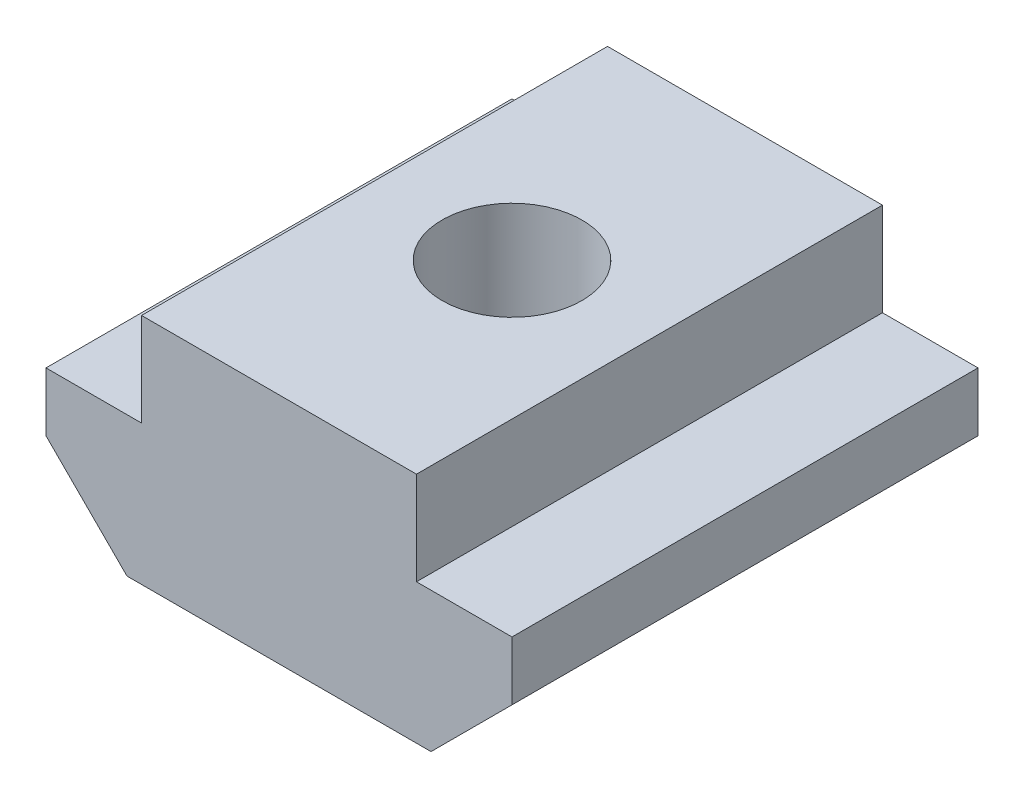
from build123d import *

# Parameters (mm, degrees)
BOSS_EXTRU_1_DEPTH      = 10
ENL_V_MAT_EXTRU_1_REACH = 18.58
ESQUISSE2_R             = 1.5


with BuildPart() as part:
    # Esquisse1 → Boss.-Extru.1 (new body)
    with BuildSketch(Plane.XY):
        Polygon((-10.506087259, -2.086075409), (-3.981368971, -2.086075409), (-2.243728115, -0.348434553), (-2.243728115, 0.913924591), (-4.293728115, 0.913924591), (-4.293728115, 2.913924591), (-10.193728115, 2.913924591), (-10.193728115, 0.913924591), (-12.243728115, 0.913924591), (-12.243728115, -0.348434553), align=None)
    extrude(amount=BOSS_EXTRU_1_DEPTH)

    # Esquisse2 → Enlèv. mat.-Extru.1 (cut, up to next)
    with BuildSketch(Plane(origin=(0, 2.913924591, 0), x_dir=(1, 0, 0), z_dir=(0, 1, 0)), mode=Mode.PRIVATE) as enl_v_mat_extru_1_sk1:
        with Locations((-7.243728115, -5)):
            Circle(ESQUISSE2_R)
    enl_v_mat_extru_1_tool1 = extrude(enl_v_mat_extru_1_sk1.sketch, amount=-ENL_V_MAT_EXTRU_1_REACH, mode=Mode.PRIVATE) & part.part
    add(enl_v_mat_extru_1_tool1.solids().sort_by_distance((-7.243728, 2.913925, 5))[0], mode=Mode.SUBTRACT)


solid = part.part
